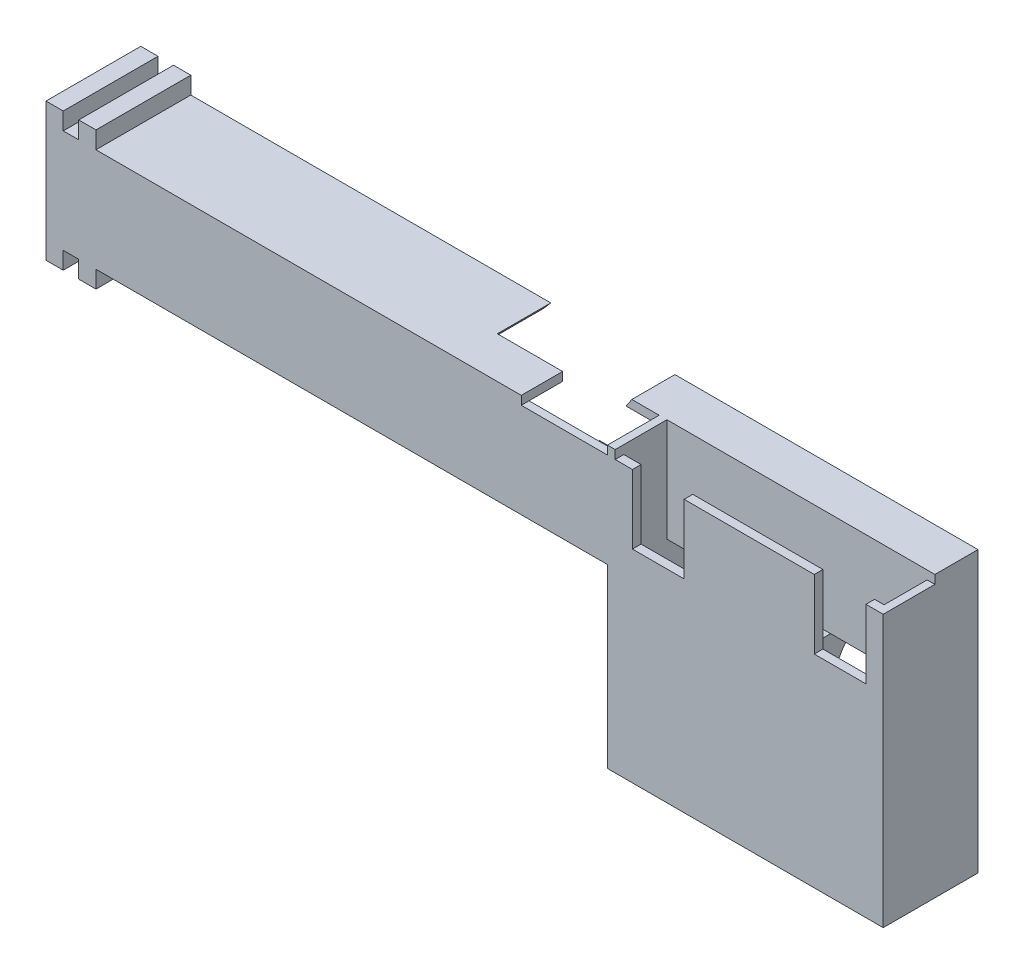
from build123d import *

# Parameters (mm, degrees)
BOSS_EXTRUDE2_DEPTH  = 11
BOSS_EXTRUDE3_DEPTH  = 5
SKETCH2_W            = 30.2
SKETCH2_H            = 1
BOSS_EXTRUDE4_DEPTH  = 25.5
SKETCH1_W            = 7.8
SKETCH1_H            = 14.5
BOSS_EXTRUDE5_DEPTH  = 11
SKETCH3_W            = 11.2
SKETCH3_H            = 11
BOSS_EXTRUDE6_DEPTH  = 5
SKETCH4_W            = 31.1
SKETCH4_H            = 4
CUT_EXTRUDE1_DEPTH   = 10
SKETCH5_W            = 32
SKETCH5_H            = 5
BOSS_EXTRUDE7_DEPTH  = 1
SKETCH7_W            = 5
SKETCH7_H            = 1
SKETCH7_H_2          = 1.003816478
BOSS_EXTRUDE8_DEPTH  = 62.24
SKETCH8_W            = 0.9
SKETCH8_H            = 1
BOSS_EXTRUDE9_DEPTH  = 6
BOSS_EXTRUDE10_DEPTH = 62.26
SKETCH10_W           = 52.24
SKETCH10_H           = 1
BOSS_EXTRUDE11_DEPTH = 6
SKETCH11_R           = 81.7
SKETCH11_R_2         = 70.15
CUT_EXTRUDE2_DEPTH   = 6.2
BOSS_EXTRUDE12_DEPTH = 2.91
SKETCH14_W           = 2
SKETCH14_H           = 11
BOSS_EXTRUDE13_DEPTH = 2
SKETCH15_W           = 2
SKETCH15_H           = 11
BOSS_EXTRUDE14_DEPTH = 2
SKETCH20_RX          = 7.25
SKETCH20_RY          = 5
CUT_EXTRUDE3_DEPTH   = 10
SKETCH21_W           = 6
SKETCH21_H           = 8
CUT_EXTRUDE4_DEPTH   = 1


with BuildPart() as part:
    # Sketch1<3> → Boss-Extrude2 (new body)
    with BuildSketch(Plane.XY):
        Polygon((0, 31.5), (0, 0), (32, 0), (32, 31.5), (31.1, 31.5), (31.1, 6), (0.9, 6), (0.9, 31.5), align=None)
    extrude(amount=BOSS_EXTRUDE2_DEPTH)

    # Sketch1<4> → Boss-Extrude3 (add)
    with BuildSketch(Plane.XY):
        Polygon((0.9, 31.5), (0.9, 20.5), (12.1, 20.5), (19.9, 20.5), (31.1, 20.5), (31.1, 31.5), align=None)
    extrude(amount=BOSS_EXTRUDE3_DEPTH)

    # Sketch2 → Boss-Extrude4 (add)
    with BuildSketch(Plane(origin=(0, 6, 0), x_dir=(1, 0, 0), z_dir=(0, 1, 0))):
        with Locations((16, -10.5)):
            Rectangle(SKETCH2_W, SKETCH2_H)
    extrude(amount=BOSS_EXTRUDE4_DEPTH)

    # Sketch1 → Boss-Extrude5 (add)
    with BuildSketch(Plane.XY):
        with Locations((16, 13.25)):
            Rectangle(SKETCH1_W, SKETCH1_H)
    extrude(amount=BOSS_EXTRUDE5_DEPTH)

    # Sketch3 → Boss-Extrude6 (add)
    with BuildSketch(Plane(origin=(0, 0, 10), x_dir=(-1, 0, 0), z_dir=(0, 0, -1))):
        with Locations((-6.5, 11.5)):
            Rectangle(SKETCH3_W, SKETCH3_H)
        with Locations((-25.5, 11.5)):
            Rectangle(SKETCH3_W, SKETCH3_H)
    extrude(amount=BOSS_EXTRUDE6_DEPTH)

    # Sketch4 → Cut-Extrude1 (cut)
    with BuildSketch(Plane(origin=(0, 31.5, 0), x_dir=(1, 0, 0), z_dir=(0, 1, 0))):
        with Locations((15.55, -2.4)):
            Rectangle(SKETCH4_W, SKETCH4_H)
    extrude(amount=-CUT_EXTRUDE1_DEPTH, mode=Mode.SUBTRACT)

    # Sketch5 → Boss-Extrude7 (add)
    with BuildSketch(Plane(origin=(0, 31.5, 0), x_dir=(1, 0, 0), z_dir=(0, 1, 0))):
        with Locations((16, -2.5)):
            Rectangle(SKETCH5_W, SKETCH5_H)
    extrude(amount=BOSS_EXTRUDE7_DEPTH)

    # Sketch7 → Boss-Extrude8 (add)
    with BuildSketch(Plane.ZY):
        with Locations((2.5, 32)):
            Rectangle(SKETCH7_W, SKETCH7_H)
        with Locations((2.5, 20.998091761)):
            Rectangle(SKETCH7_W, SKETCH7_H_2)
    extrude(amount=BOSS_EXTRUDE8_DEPTH)

    # Sketch8 → Boss-Extrude9 (add)
    with BuildSketch(Plane.XY.offset(5)):
        with Locations((0.45, 32)):
            Rectangle(SKETCH8_W, SKETCH8_H)
    extrude(amount=BOSS_EXTRUDE9_DEPTH)

    # Sketch9 → Boss-Extrude10 (add)
    with BuildSketch(Plane.ZY):
        Polygon((11, 31.5), (10.1, 31.5), (10.1, 21.499511858), (5, 21.499511858), (5, 20.496183522), (11, 20.496183522), align=None)
    extrude(amount=BOSS_EXTRUDE10_DEPTH)

    # Sketch10 → Boss-Extrude11 (add)
    with BuildSketch(Plane.XY.offset(5)):
        with Locations((-36.12, 32)):
            Rectangle(SKETCH10_W, SKETCH10_H)
    extrude(amount=BOSS_EXTRUDE11_DEPTH)

    # Sketch11 → Cut-Extrude2 (cut)
    with BuildSketch(Plane(origin=(0, 0, 0), x_dir=(-1, 0, 0), z_dir=(0, 0, -1))):
        with Locations((71.241875, 77.677250508)):
            Circle(SKETCH11_R)
        with Locations((71.241875, 77.677250508)):
            Circle(SKETCH11_R_2, mode=Mode.SUBTRACT)
    extrude(amount=-CUT_EXTRUDE2_DEPTH, mode=Mode.SUBTRACT)

    # Sketch12 → Boss-Extrude12 (add)
    with BuildSketch(Plane.ZY.offset(62.24)):
        Polygon((11, 32.5), (0, 32.5), (0, 31.5), (10.1, 31.5), (10.1, 21.5), (0, 21.5), (0, 20.496183522), (11, 20.496183522), align=None)
    extrude(amount=BOSS_EXTRUDE12_DEPTH)

    # Sketch14 → Boss-Extrude13 (add)
    with BuildSketch(Plane(origin=(0, 20.496183522, 0), x_dir=(-1, 0, 0), z_dir=(0, -1, 0))):
        with Locations((64.15, -5.5)):
            Rectangle(SKETCH14_W, SKETCH14_H)
        with Locations((60.35, -5.5)):
            Rectangle(SKETCH14_W, SKETCH14_H)
    extrude(amount=BOSS_EXTRUDE13_DEPTH)

    # Sketch15 → Boss-Extrude14 (add)
    with BuildSketch(Plane(origin=(0, 32.5, 0), x_dir=(1, 0, 0), z_dir=(0, 1, 0))):
        with Locations((-64.15, -5.5)):
            Rectangle(SKETCH15_W, SKETCH15_H)
        with Locations((-60.35, -5.5)):
            Rectangle(SKETCH15_W, SKETCH15_H)
    extrude(amount=BOSS_EXTRUDE14_DEPTH)

    # Sketch20 → Cut-Extrude3 (cut)
    with BuildSketch(Plane(origin=(19.9, 0, 0), x_dir=(0, 0, -1), z_dir=(1, 0, 0))):
        with Locations(Location((0, 13.25), (0, 0, -90))):
            Ellipse(SKETCH20_RX, SKETCH20_RY)
    extrude(amount=-CUT_EXTRUDE3_DEPTH, mode=Mode.SUBTRACT)

    # Sketch21 → Cut-Extrude4 (cut)
    with BuildSketch(Plane.XY.offset(11)):
        with Locations((5.9, 27.5)):
            Rectangle(SKETCH21_W, SKETCH21_H)
        with Locations((27, 27.5)):
            Rectangle(SKETCH21_W, SKETCH21_H)
    extrude(amount=-CUT_EXTRUDE4_DEPTH, mode=Mode.SUBTRACT)


solid = part.part
